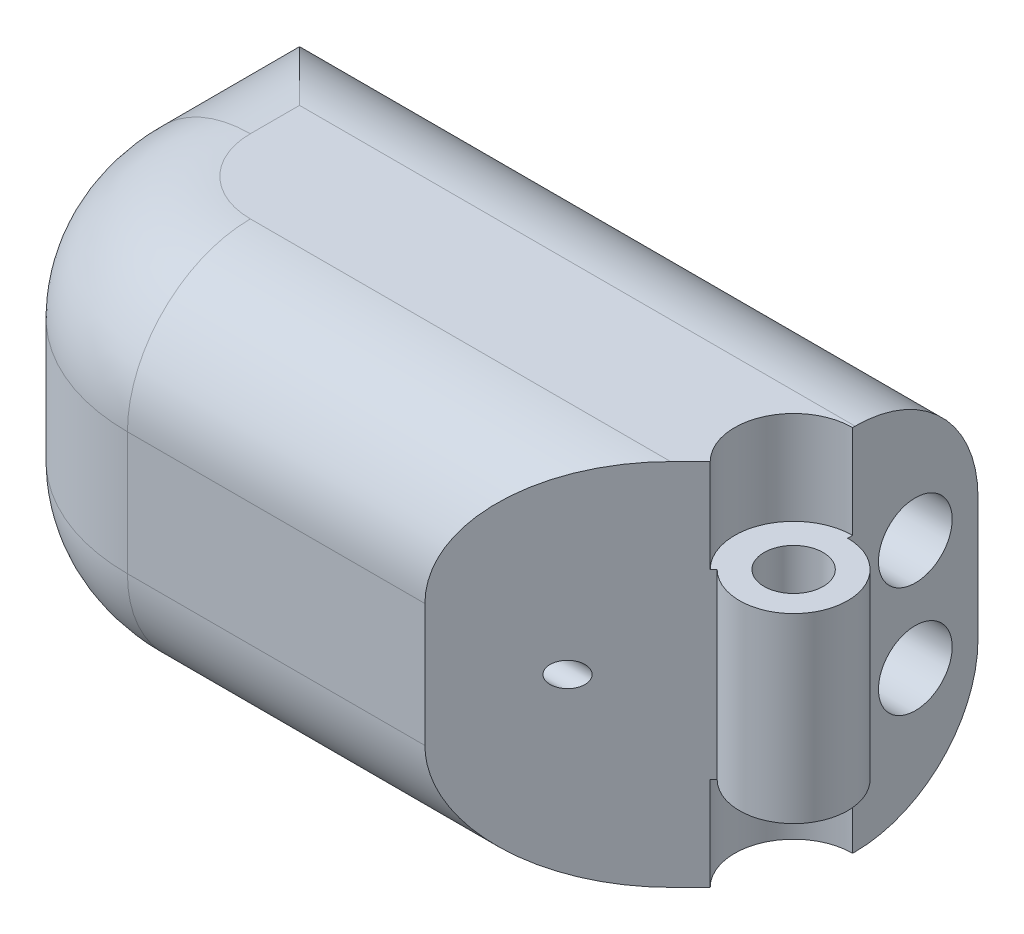
from build123d import *

# Parameters (mm, degrees)
BOSS_EXTRUDE1_DEPTH      = 7.5
BOSS_EXTRUDE1_DEPTH_BACK = 7.5
CUT_EXTRUDE3_REACH       = 31.568
SKETCH5_R                = 1.5
BOSS_EXTRUDE2_DEPTH      = 3.7
BOSS_EXTRUDE2_DEPTH_BACK = 3.7
SKETCH6_R                = 1.2
FILLET1_R                = 8
FILLET2_R                = 5
CUT_EXTRUDE4_START       = -12.346261552
CUT_EXTRUDE4_OUTLINE_R   = 0.5
CUT_EXTRUDE4_DEPTH       = 22.047733515


# Read off the part's stored shape, not the designer's step: Cut-Extrude4
with BuildPart() as part:
    # Sketch1 → Boss-Extrude1 (new, two sides: drawn at the far end of the back side and taken through both)
    with BuildSketch(Plane(origin=(0, 0, 0), x_dir=(-1, 0, 0), z_dir=(0, 1, 0)).offset(-BOSS_EXTRUDE1_DEPTH_BACK)):
        with BuildLine():
            Line((-13.8, -7.5), (13.8, -7.5))
            Line((13.8, -7.5), (13.8, 7.5))
            Line((13.8, 7.5), (-6.3, 7.5))
            Line((-6.3, 7.5), (-12.102943725, 1.697056275))
            ThreePointArc((-12.102943725, 1.697056275), (-11.582689122, -0.918440238), (-13.8, -2.4))
            Line((-13.8, -2.4), (-13.8, -7.5))
        make_face()
    extrude(amount=BOSS_EXTRUDE1_DEPTH + BOSS_EXTRUDE1_DEPTH_BACK)

    # Sketch5 → Cut-Extrude3 (cut, up to next)
    with BuildSketch(Plane.YZ.offset(13.8), mode=Mode.PRIVATE) as cut_extrude3_sk1:
        with Locations(Location((-2.25, -4.95, 0), (0, 0, 270))):
            Circle(SKETCH5_R)
    cut_extrude3_tool1 = extrude(cut_extrude3_sk1.sketch, amount=-CUT_EXTRUDE3_REACH, mode=Mode.PRIVATE) & part.part
    # Sketch5 → Cut-Extrude3 (cut, up to next)
    with BuildSketch(Plane.YZ.offset(13.8), mode=Mode.PRIVATE) as cut_extrude3_sk2:
        with Locations(Location((2.25, -4.95, 0), (0, 0, 270))):
            Circle(SKETCH5_R)
    cut_extrude3_tool2 = extrude(cut_extrude3_sk2.sketch, amount=-CUT_EXTRUDE3_REACH, mode=Mode.PRIVATE) & part.part
    add(cut_extrude3_tool1.solids().sort_by_distance((13.8, -2.25, -4.95))[0], mode=Mode.SUBTRACT)
    add(cut_extrude3_tool2.solids().sort_by_distance((13.8, 2.25, -4.95))[0], mode=Mode.SUBTRACT)

    # Sketch6 → Boss-Extrude2 (add, two sides: drawn at the far end of the back side and taken through both)
    with BuildSketch(Plane(origin=(0, 0, 0), x_dir=(-1, 0, 0), z_dir=(0, 1, 0)).offset(-BOSS_EXTRUDE2_DEPTH_BACK)):
        with BuildLine():
            Line((-12.102943725, 1.697056275), (-12.244365081, 1.555634919))
            ThreePointArc((-12.244365081, 1.555634919), (-15.832534972, 0.841903551), (-13.8, -2.2))
            Line((-13.8, -2.2), (-13.8, -2.4))
            ThreePointArc((-13.8, -2.4), (-11.582689122, -0.918440238), (-12.102943725, 1.697056275))
        make_face()
        with Locations(Location((-13.8, 0, 0), (0, 0, 90))):
            Circle(SKETCH6_R, mode=Mode.SUBTRACT)
    extrude(amount=BOSS_EXTRUDE2_DEPTH + BOSS_EXTRUDE2_DEPTH_BACK)

    # Fillet1
    fillet1_edges = [part.edges().sort_by_distance(p)[0] for p in [
        (-13.8, 0, 7.5),
    ]]
    fillet(fillet1_edges, radius=FILLET1_R)

    # Fillet2
    # the kernel refuses this fillet: 5 mm, written as the material it takes off along each edge
    with BuildSketch(Plane(origin=(26.3, -7.5, -7.5), x_dir=(0, 1, 0), z_dir=(-1, 0, 0)), Plane(origin=(26.3, 7.5, -7.5), x_dir=(0, 0, 1), z_dir=(-1, 0, 0))) as fillet2_piece_1:
        with BuildLine():
            CenterArc((FILLET2_R, -FILLET2_R), FILLET2_R, 90, 90)
            Line((0, -FILLET2_R), (0, 0))
            Line((0, 0), (FILLET2_R, 0))
        make_face()
    extrude(amount=52.6, mode=Mode.SUBTRACT)
    with BuildSketch(Plane(origin=(-5.8, 7.5, 7.5), x_dir=(0, 0, -1), z_dir=(1, 0, 0)), Plane(origin=(-5.8, -7.5, 7.5), x_dir=(0, 1, 0), z_dir=(1, 0, 0))) as fillet2_piece_2:
        with BuildLine():
            CenterArc((FILLET2_R, -FILLET2_R), FILLET2_R, 90, 90)
            Line((0, -FILLET2_R), (0, 0))
            Line((0, 0), (FILLET2_R, 0))
        make_face()
    extrude(amount=24.6, mode=Mode.SUBTRACT)
    with BuildSketch(Plane(origin=(-13.8, 7.5, -20), x_dir=(1, 0, 0), z_dir=(0, 0, 1)), Plane(origin=(-13.8, -7.5, -20), x_dir=(0, 1, 0), z_dir=(0, 0, 1))) as fillet2_piece_3:
        with BuildLine():
            CenterArc((FILLET2_R, -FILLET2_R), FILLET2_R, 90, 90)
            Line((0, -FILLET2_R), (0, 0))
            Line((0, 0), (FILLET2_R, 0))
        make_face()
    extrude(amount=19.5, mode=Mode.SUBTRACT)
    with BuildSketch(Plane(origin=(-5.8, 7.5, -0.5), x_dir=(0, 0, 1), z_dir=(1, 0, 0))) as fillet2_piece_4:
        with BuildLine():
            CenterArc((8 - FILLET2_R, FILLET2_R), FILLET2_R, 270, 90)
            Line((8, FILLET2_R), (8, 0))
            Line((8, 0), (8 - FILLET2_R, 0))
        make_face()
    revolve(axis=Axis((-5.8, 7.5, -0.5), (0, -1, 0)), revolution_arc=90, mode=Mode.SUBTRACT)
    with BuildSketch(Plane(origin=(-5.8, -7.5, -0.5), x_dir=(0, 0, 1), z_dir=(1, 0, 0))) as fillet2_piece_5:
        with BuildLine():
            CenterArc((8 - FILLET2_R, -FILLET2_R), FILLET2_R, 0, 90)
            Line((8 - FILLET2_R, 0), (8, 0))
            Line((8, 0), (8, -FILLET2_R))
        make_face()
    revolve(axis=Axis((-5.8, -7.5, -0.5), (0, -1, 0)), revolution_arc=90, mode=Mode.SUBTRACT)

    # Cut-Extrude4 outline → Cut-Extrude4 (cut)
    with BuildSketch(Plane.YZ.offset(CUT_EXTRUDE4_START)):
        with Locations((0, 4.598528137)):
            Circle(CUT_EXTRUDE4_OUTLINE_R)
    extrude(amount=CUT_EXTRUDE4_DEPTH, mode=Mode.SUBTRACT)


solid = part.part
